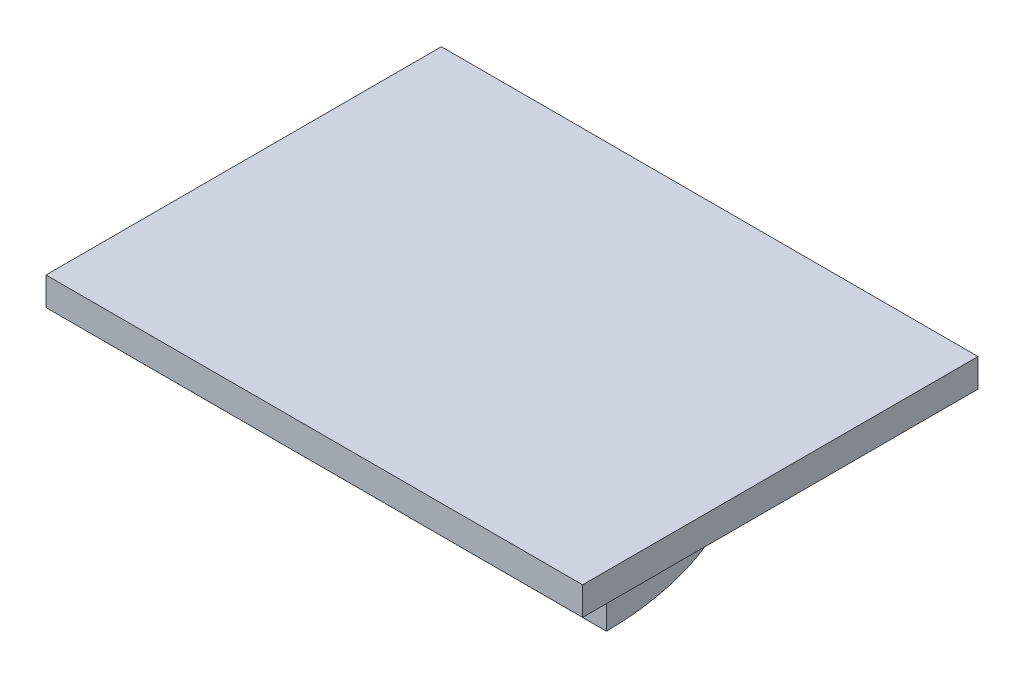
from build123d import *

# Parameters (mm, degrees)
SKETCH3_W           = 17.9
SKETCH3_H           = 11.9
BOSS_EXTRUDE3_DEPTH = 1.4
FILLET2_R           = 12
SKETCH4_W           = 19
SKETCH4_H           = 14
BOSS_EXTRUDE4_DEPTH = 1


with BuildPart() as part:
    # Sketch3 → Boss-Extrude3 (new body)
    with BuildSketch(Plane(origin=(0, 0, 0), x_dir=(1, 0, 0), z_dir=(0, 1, 0))):
        with Locations((19.738575208, -2.596225655)):
            Rectangle(SKETCH3_W, SKETCH3_H)
    extrude(amount=BOSS_EXTRUDE3_DEPTH)

    # Fillet2
    # the kernel refuses this fillet: 12 mm, written as the material it takes off along each edge
    with BuildSketch(Plane(origin=(10.788575208, -30, -3.353774345), x_dir=(1, 0, 0), z_dir=(0, 1, 0))) as fillet2_piece_1:
        with BuildLine():
            CenterArc((FILLET2_R, -FILLET2_R), FILLET2_R, 90, 90)
            Line((0, -FILLET2_R), (0, 0))
            Line((0, 0), (FILLET2_R, 0))
        make_face()
    extrude(amount=61.4, mode=Mode.SUBTRACT)
    with BuildSketch(Plane(origin=(28.688575208, -30, -3.353774345), x_dir=(-1, 0, 0), z_dir=(0, 1, 0))) as fillet2_piece_2:
        with BuildLine():
            CenterArc((FILLET2_R, FILLET2_R), FILLET2_R, 180, 90)
            Line((0, FILLET2_R), (0, 0))
            Line((0, 0), (FILLET2_R, 0))
        make_face()
    extrude(amount=61.4, mode=Mode.SUBTRACT)

    # Sketch4 → Boss-Extrude4 (add)
    with BuildSketch(Plane(origin=(0, 1.4, 0), x_dir=(1, 0, 0), z_dir=(0, 1, 0))):
        with Locations((19.738575208, -2.944154074)):
            Rectangle(SKETCH4_W, SKETCH4_H)
    extrude(amount=BOSS_EXTRUDE4_DEPTH)


solid = part.part
